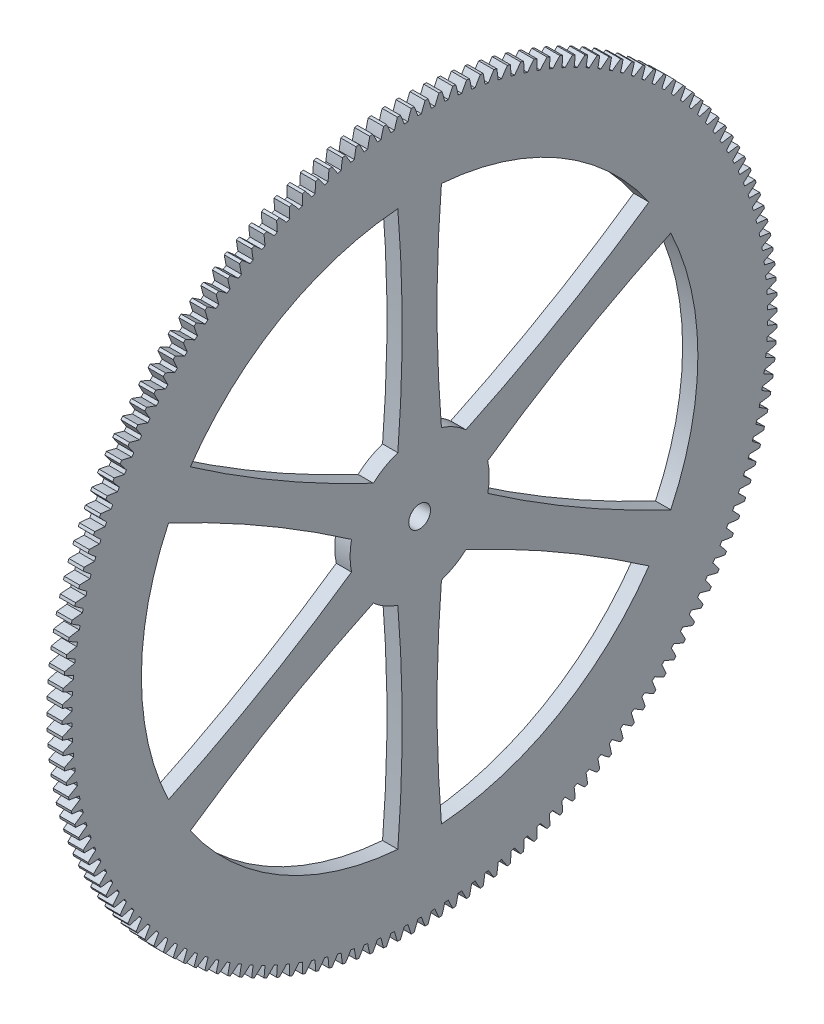
from build123d import *

# Parameters (mm, degrees)
BASPROSKE_W        = 4.445
BASPROSKE_H        = 104.14
TOOTHCUT_DEPTH     = 148.343263249
TEETHCUTS_COUNT    = 162
TEETHCUTS_ANGLE    = 357.777777778
BORSKE_R           = 3.175
BORE_DEPTH         = 50.8000508
CUT_EXTRUDE1_DEPTH = 148.334662863


with BuildPart() as part:
    # BasProSke → Base-Revolve (revolve)
    with BuildSketch(Plane(origin=(0, 0, 0), x_dir=(1, 0, 0), z_dir=(0, 1, 0)), mode=Mode.PRIVATE) as base_revolve_sk:
        with Locations((2.2225, 52.07)):
            Rectangle(BASPROSKE_W, BASPROSKE_H)
    revolve(base_revolve_sk.sketch.rotate(Axis((-10, 0, 0), (1, 0, 0)), 180), axis=Axis((-10, 0, 0), (1, 0, 0)))

    # TooCutSke → ToothCut (cut, through all)
    with BuildSketch(Plane(origin=(0, 0, 0), x_dir=(0, 0, -1), z_dir=(1, 0, 0))):
        with BuildLine():
            ThreePointArc((0.524044892, 101.293844433), (0, 101.2952), (-0.524044892, 101.293844433))
            ThreePointArc((-0.524044892, 101.293844433), (-1.036750483, 102.733473608), (-1.602559851, 104.15307177))
            ThreePointArc((-1.602559851, 104.15307177), (0, 104.1654), (1.602559851, 104.15307177))
            ThreePointArc((1.602559851, 104.15307177), (1.036750483, 102.733473608), (0.524044892, 101.293844433))
        make_face()
    toothcut = extrude(amount=TOOTHCUT_DEPTH, mode=Mode.SUBTRACT)

    # TeethCuts: ToothCut ×162 about axis
    teethcuts_axis = Axis((-10, 0, 0), (1, 0, 0))
    for i in range(1, TEETHCUTS_COUNT):
        add(toothcut.rotate(teethcuts_axis, i * TEETHCUTS_ANGLE / (TEETHCUTS_COUNT - 1)), mode=Mode.SUBTRACT)

    # BorSke → Bore (cut, symmetric)
    with BuildSketch(Plane(origin=(0, 0, 0), x_dir=(0, 0, -1), z_dir=(1, 0, 0))):
        with Locations(Location((0, 0, 0), (0, 0, 180))):
            Circle(BORSKE_R)
    extrude(amount=BORE_DEPTH, both=True, mode=Mode.SUBTRACT)

    # Sketch2 → Cut-Extrude1 (cut, through all)
    with BuildSketch(Plane(origin=(4.445, 0, 0), x_dir=(0, 0, -1), z_dir=(1, 0, 0))):
        with BuildLine():
            Line((-6.35, 19.238144446), (-6.35, 80.786983652))
            ThreePointArc((-6.35, 80.786983652), (-40.51808, 70.179373185), (-66.788580138, 45.89275314))
            ThreePointArc((-66.788580138, 45.89275314), (-40.772150975, 29.405691076), (-13.485721812, 15.118333537))
            ThreePointArc((-13.485721812, 15.118333537), (-10.12952, 17.544843296), (-6.35, 19.238144446))
        make_face()
        with BuildLine():
            ThreePointArc((66.788580138, 45.89275314), (40.51808, 70.179373185), (6.35, 80.786983652))
            Line((6.35, 80.786983652), (6.35, 19.238144446))
            ThreePointArc((6.35, 19.238144446), (10.12952, 17.544843296), (13.485721812, 15.118333537))
            ThreePointArc((13.485721812, 15.118333537), (40.772150975, 29.405691076), (66.788580138, 45.89275314))
        make_face()
        with BuildLine():
            ThreePointArc((81.03616, 0), (79.037108088, 17.888397711), (73.138580138, 34.894230512))
            ThreePointArc((73.138580138, 34.894230512), (45.852150975, 20.606872973), (19.835721812, 4.119810909))
            ThreePointArc((19.835721812, 4.119810909), (20.152932582, 2.070751084), (20.25904, 0))
            ThreePointArc((20.25904, 0), (20.152932582, -2.070751084), (19.835721812, -4.119810909))
            ThreePointArc((19.835721812, -4.119810909), (45.852150975, -20.606872973), (73.138580138, -34.894230512))
            ThreePointArc((73.138580138, -34.894230512), (79.037108088, -17.888397711), (81.03616, 0))
        make_face()
        with BuildLine():
            ThreePointArc((6.35, -80.786983652), (40.51808, -70.179373185), (66.788580138, -45.89275314))
            ThreePointArc((66.788580138, -45.89275314), (40.772150975, -29.405691076), (13.485721812, -15.118333537))
            ThreePointArc((13.485721812, -15.118333537), (10.12952, -17.544843296), (6.35, -19.238144446))
            ThreePointArc((6.35, -19.238144446), (5.08, -50.012564049), (6.35, -80.786983652))
        make_face()
        with BuildLine():
            ThreePointArc((-13.485721812, -15.118333537), (-40.772150975, -29.405691076), (-66.788580138, -45.89275314))
            ThreePointArc((-66.788580138, -45.89275314), (-40.51808, -70.179373185), (-6.35, -80.786983652))
            ThreePointArc((-6.35, -80.786983652), (-5.08, -50.012564049), (-6.35, -19.238144446))
            ThreePointArc((-6.35, -19.238144446), (-10.12952, -17.544843296), (-13.485721812, -15.118333537))
        make_face()
        with BuildLine():
            ThreePointArc((-19.835721812, 4.119810909), (-45.852150975, 20.606872973), (-73.138580138, 34.894230512))
            ThreePointArc((-73.138580138, 34.894230512), (-81.03616, 0), (-73.138580138, -34.894230512))
            ThreePointArc((-73.138580138, -34.894230512), (-45.852150975, -20.606872973), (-19.835721812, -4.119810909))
            ThreePointArc((-19.835721812, -4.119810909), (-20.25904, 0), (-19.835721812, 4.119810909))
        make_face()
        with BuildLine():
            Line((-6.35, 80.786983652), (-6.35, 19.238144446))
            ThreePointArc((-6.35, 19.238144446), (-5.08, 50.012564049), (-6.35, 80.786983652))
        make_face()
        with BuildLine():
            ThreePointArc((6.35, 19.238144446), (5.08, 50.012564049), (6.35, 80.786983652))
            Line((6.35, 80.786983652), (6.35, 19.238144446))
        make_face()
    extrude(amount=-CUT_EXTRUDE1_DEPTH, mode=Mode.SUBTRACT)


solid = part.part
